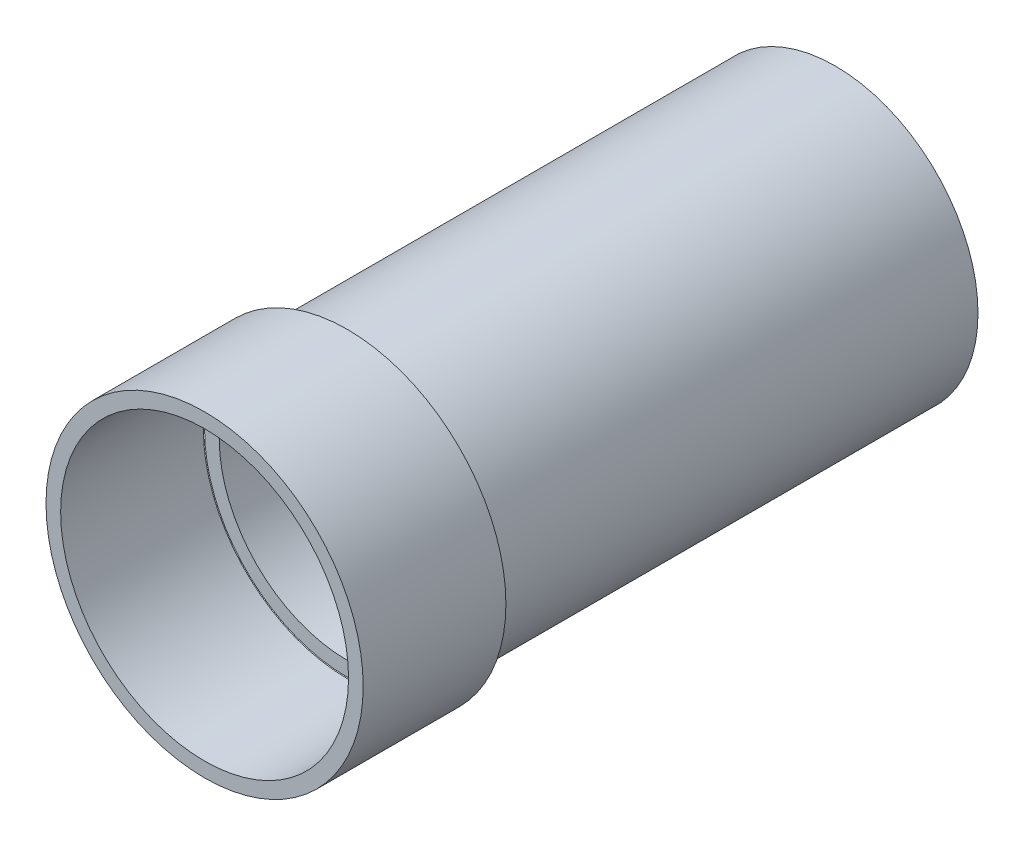
from build123d import *

# Parameters (mm, degrees)
SKETCH1_R           = 23.4
SKETCH1_R_2         = 21
BOSS_EXTRUDE1_DEPTH = 80
SKETCH9_R           = 26
SKETCH9_R_2         = 23.6
BOSS_EXTRUDE6_DEPTH = 23.4


with BuildPart() as part:
    # Sketch1 → Boss-Extrude1 (new body)
    with BuildSketch(Plane.XY):
        Circle(SKETCH1_R)
        Circle(SKETCH1_R_2, mode=Mode.SUBTRACT)
    extrude(amount=BOSS_EXTRUDE1_DEPTH)


with BuildPart() as body_2:
    # Sketch9 → Boss-Extrude6 (new body)
    with BuildSketch(Plane.XY.offset(80)):
        Circle(SKETCH9_R)
        Circle(SKETCH9_R_2, mode=Mode.SUBTRACT)
    extrude(amount=BOSS_EXTRUDE6_DEPTH)


solid = Compound([part.part, body_2.part])
